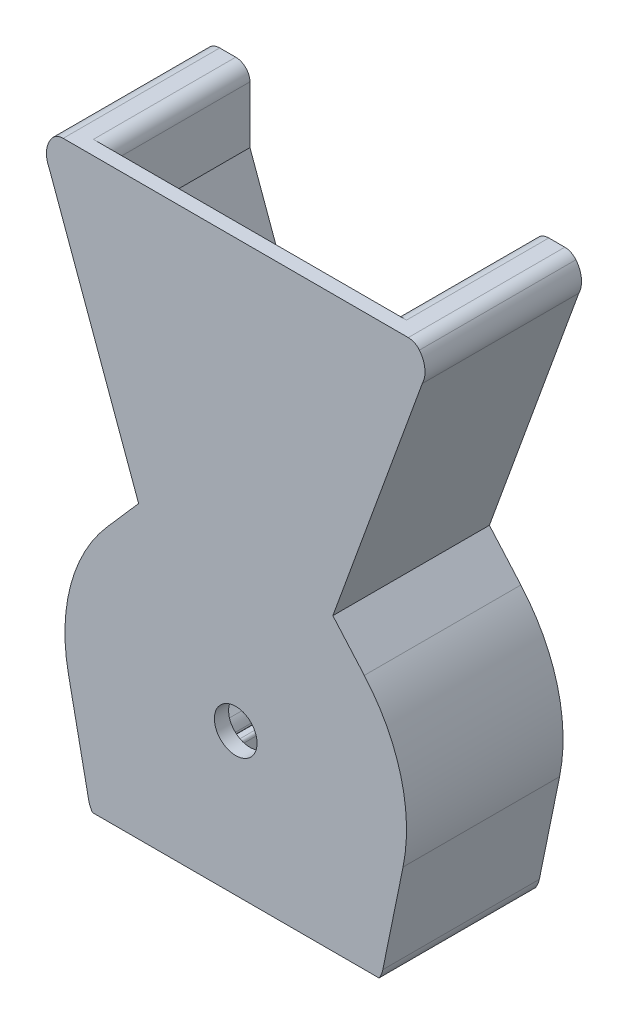
from build123d import *

# Parameters (mm, degrees)
BOSS_EXTRUDE1_DEPTH     = 50
BOSS_EXTRUDE1_2_DEPTH   = 50
BOSS_EXTRUDE2_DEPTH     = 10
CHAMFER1_SIZE           = 15
CHAMFER1_SIZE_2         = 20
SKETCH4_W               = 160
SKETCH4_H               = 200
BOSS_EXTRUDE3_DEPTH     = 5
FILLET1_R               = 10
SKETCH5_R               = 7.5
CUT_EXTRUDE1_DEPTH      = 5
CUT_EXTRUDE5_DEPTH      = 140.373598648
CUT_EXTRUDE5_DEPTH_BACK = 140.373598648
FILLET4_R               = 5
SKETCH12_R              = 2
CUT_EXTRUDE6_DEPTH      = 10
SKETCH13_W              = 22.9
SKETCH13_H              = 1.9875
CUT_EXTRUDE7_DEPTH      = 50
FILLET5_R               = 1


with BuildPart() as part:
    # Sketch2 → Boss-Extrude1 (new body)
    with BuildSketch(Plane.XY):
        with BuildLine():
            Line((-50, 75), (-22.70223243, 0))
            Line((-22.70223243, 0), (-37.64392369, -17.092022104))
            ThreePointArc((-37.64392369, -17.092022104), (-49.971924127, -51.675350432), (-35.355339059, -85.355339059))
            Line((-35.355339059, -85.355339059), (-35.355339059, -100))
            Line((-35.355339059, -100), (-80, -100))
            Line((-80, -100), (-80, 100))
            Line((-80, 100), (-50, 100))
            Line((-50, 100), (-50, 75))
        make_face()
    extrude(amount=-BOSS_EXTRUDE1_DEPTH)



with BuildPart() as body_2:
    # Sketch2 → Boss-Extrude1 2 (new body)
    with BuildSketch(Plane.XY):
        with BuildLine():
            Line((50, 75), (22.70223243, 0))
            Line((22.70223243, 0), (37.64392369, -17.092022104))
            ThreePointArc((37.64392369, -17.092022104), (49.971924127, -51.675350432), (35.355339059, -85.355339059))
            Line((35.355339059, -85.355339059), (35.355339059, -100))
            Line((35.355339059, -100), (80, -100))
            Line((80, -100), (80, 100))
            Line((80, 100), (50, 100))
            Line((50, 100), (50, 75))
        make_face()
    extrude(amount=-BOSS_EXTRUDE1_2_DEPTH)


with BuildPart() as part_1:
    add(part.part)

    add(body_2.part)  # Boss-Extrude2 merges body 2
    # Sketch3 → Boss-Extrude2 (add)
    with BuildSketch(Plane.XY):
        Polygon((-29.981637115, 20), (29.981637115, 20), (22.70223243, 0), (-22.70223243, 0), align=None)
    extrude(amount=-BOSS_EXTRUDE2_DEPTH)

    # Chamfer1
    # the kernel refuses this chamfer: 20, 15 mm, written as the material it takes off along each edge
    with BuildSketch(Plane(origin=(-81.595588718, 20, -10), x_dir=(0, 0.041308380137954244, 0.9991464445867674), z_dir=(1, 0, 0))) as chamfer1_piece_1_section:
        Polygon((CHAMFER1_SIZE * 0.999146444587, CHAMFER1_SIZE * 0.041308380138), (-CHAMFER1_SIZE_2 * 0.041308380138, CHAMFER1_SIZE_2 * 0.999146444587), (0, 0), align=None)
    chamfer1_piece_1 = extrude(amount=163.191177435, mode=Mode.PRIVATE)
    chamfer1_piece_1 = split(chamfer1_piece_1, bisect_by=Plane(origin=(-24.447399798, 4.794807938, -4.975922198), z_dir=(0.9396926207859094, 0.3420201433256661, 0)), keep=Keep.TOP, mode=Mode.PRIVATE)
    chamfer1_piece_1 = split(chamfer1_piece_1, bisect_by=Plane(origin=(24.447399798, 4.794807938, -4.975922198), z_dir=(-0.939692620785907, 0.34202014332567265, 0)), keep=Keep.TOP, mode=Mode.PRIVATE)
    add(chamfer1_piece_1, mode=Mode.SUBTRACT)

    # Sketch4 → Boss-Extrude3 (add)
    with BuildSketch(Plane.XY):
        Rectangle(SKETCH4_W, SKETCH4_H)
    extrude(amount=BOSS_EXTRUDE3_DEPTH)

    # Fillet1
    fillet1_edges = [part_1.edges().sort_by_distance(p)[0] for p in [
        (-22.70223243, 0, -30),
        (-35.355339059, -85.355339059, -25),
        (35.355339059, -85.355339059, -25),
        (22.70223243, 0, -30),
        (0, 13.333333333, 0),
    ]]
    fillet(fillet1_edges, radius=FILLET1_R)

    # Sketch5 → Cut-Extrude1 (cut)
    with BuildSketch(Plane(origin=(0, 0, 0), x_dir=(-1, 0, 0), z_dir=(0, 0, -1))):
        with Locations((0, -50)):
            Circle(SKETCH5_R)
    extrude(amount=-CUT_EXTRUDE1_DEPTH, mode=Mode.SUBTRACT)

    # Sketch11 → Cut-Extrude5 (cut, two sides: drawn at the far end of the back side and taken through both)
    with BuildSketch(Plane(origin=(0, 0, -50), x_dir=(-1, 0, 0), z_dir=(0, 0, -1)).offset(-CUT_EXTRUDE5_DEPTH_BACK)):
        with BuildLine():
            Line((-58.784198233, -62.017405631), (-51.672968794, -96.802610845))
            ThreePointArc((-51.672968794, -96.802610845), (-51.161121522, -98.466118532), (-50.338653833, -100))
            Line((-50.338653833, -100), (-80, -100))
            Line((-80, -100), (-80, 100))
            Line((-80, 100), (-62.474937186, 100))
            ThreePointArc((-62.474937186, 100), (-66.199502533, 94.806221081), (-65.536970349, 88.4494312))
            Line((-65.536970349, 88.4494312), (-60, 73.236730193))
            Line((-60, 73.236730193), (-34.120235365, 2.132661237))
            Line((-34.120235365, 2.132661237), (-45.172708428, -10.510426525))
            ThreePointArc((-45.172708428, -10.510426525), (-58.008635864, -34.670350128), (-58.784198233, -62.017405631))
        make_face()
        with BuildLine():
            Line((34.120235365, 2.132661237), (45.172708428, -10.510426525))
            ThreePointArc((45.172708428, -10.510426525), (58.008635864, -34.670350128), (58.784198233, -62.017405631))
            Line((58.784198233, -62.017405631), (51.672968794, -96.802610845))
            ThreePointArc((51.672968794, -96.802610845), (51.161121522, -98.466118532), (50.338653833, -100))
            Line((50.338653833, -100), (80, -100))
            Line((80, -100), (80, 100))
            Line((80, 100), (62.474937186, 100))
            ThreePointArc((62.474937186, 100), (66.199502533, 94.806221081), (65.536970349, 88.4494312))
            Line((65.536970349, 88.4494312), (60, 73.236730193))
            Line((60, 73.236730193), (34.120235365, 2.132661237))
        make_face()
    extrude(amount=CUT_EXTRUDE5_DEPTH + CUT_EXTRUDE5_DEPTH_BACK, mode=Mode.SUBTRACT)

    # Fillet4
    fillet4_edges = [part_1.edges().sort_by_distance(p)[0] for p in [
        (-35.355339059, -100, -25),
        (-50, 100, -25),
        (62.474937186, 100, -22.5),
        (-62.474937186, 100, -22.5),
        (50, 100, -25),
        (35.355339059, -100, -25),
    ]]
    fillet(fillet4_edges, radius=FILLET4_R)

    # Sketch12 → Cut-Extrude6 (cut)
    with BuildSketch(Plane(origin=(0, 0, -50), x_dir=(-1, 0, 0), z_dir=(0, 0, -1))):
        with Locations((-57.5, 92.5)):
            Circle(SKETCH12_R)
        with Locations((57.5, 92.5)):
            Circle(SKETCH12_R)
        with Locations((-42.855339059, -95)):
            Circle(SKETCH12_R)
        with Locations((42.855339059, -95)):
            Circle(SKETCH12_R)
    extrude(amount=-CUT_EXTRUDE6_DEPTH, mode=Mode.SUBTRACT)

    # Sketch13 → Cut-Extrude7 (cut)
    with BuildSketch(Plane(origin=(0, 0, -50), x_dir=(-1, 0, 0), z_dir=(0, 0, -1))):
        with Locations((-34.105339059, -88.485929464)):
            Rectangle(SKETCH13_W, SKETCH13_H)
        with Locations((34.105339059, -88.485929464)):
            Rectangle(SKETCH13_W, SKETCH13_H)
    extrude(amount=-CUT_EXTRUDE7_DEPTH, mode=Mode.SUBTRACT)

    # Fillet5
    fillet5_edges = [part_1.edges().sort_by_distance(p)[0] for p in [
        (-35.516393803, -87.492179464, -25),
        (35.516393803, -87.492179464, -25),
        (35.355339059, -89.479679464, -25),
        (-35.355339059, -89.479679464, -25),
    ]]
    fillet(fillet5_edges, radius=FILLET5_R)


solid = part_1.part
